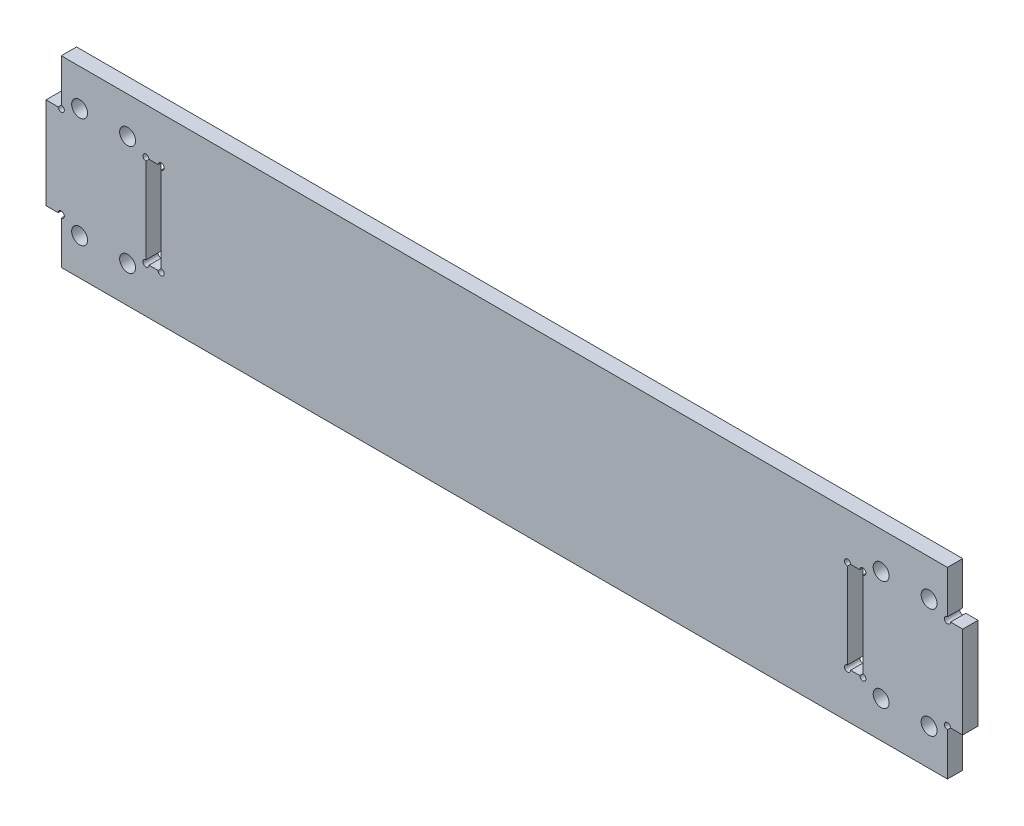
from build123d import *

# Parameters (mm, degrees)
SKETCH_1_W          = 290
SKETCH_1_H          = 60
EXTRUDE_1_DEPTH     = 5
SKETCH_2_W          = 5
SKETCH_2_H          = 30
EXTRUDE_2_DEPTH     = 5
CUT_EXTRUDE_1_DEPTH = 5
CUT_EXTRUDE_2_DEPTH = 5
SKETCH_5_R          = 2.6
CUT_EXTRUDE_3_DEPTH = 302.081384346


with BuildPart() as part:
    # 草图1 → 凸台-拉伸1 (new body)
    with BuildSketch(Plane.XY):
        with Locations((145, -30)):
            Rectangle(SKETCH_1_W, SKETCH_1_H)
    extrude(amount=EXTRUDE_1_DEPTH)

    # 草图2 → 凸台-拉伸2 (add)
    with BuildSketch(Plane.XY.offset(5)):
        with Locations((292.5, -30)):
            Rectangle(SKETCH_2_W, SKETCH_2_H)
        with Locations((-2.5, -30)):
            Rectangle(SKETCH_2_W, SKETCH_2_H)
    extrude(amount=-EXTRUDE_2_DEPTH)

    # 草图3 → 切除-拉伸1 (cut)
    with BuildSketch(Plane(origin=(0, 0, 0), x_dir=(-1, 0, 0), z_dir=(0, 0, -1))):
        with BuildLine():
            Line((1, -15), (0, -15))
            Line((0, -15), (0, -14))
            ThreePointArc((0, -14), (-0.707106781, -15.707106781), (1, -15))
        make_face()
        with BuildLine():
            ThreePointArc((-291, -15), (-289.292893219, -15.707106781), (-290, -14))
            Line((-290, -14), (-290, -15))
            Line((-290, -15), (-291, -15))
        make_face()
        with BuildLine():
            Line((0, -45), (1, -45))
            ThreePointArc((1, -45), (-0.707106781, -44.292893219), (0, -46))
            Line((0, -46), (0, -45))
        make_face()
        with BuildLine():
            ThreePointArc((-290, -46), (-289.292893219, -44.292893219), (-291, -45))
            Line((-291, -45), (-290, -45))
            Line((-290, -45), (-290, -46))
        make_face()
    extrude(amount=-CUT_EXTRUDE_1_DEPTH, mode=Mode.SUBTRACT)

    # 草图4 → 切除-拉伸2 (cut)
    with BuildSketch(Plane(origin=(0, 0, 0), x_dir=(-1, 0, 0), z_dir=(0, 0, -1))):
        with BuildLine():
            ThreePointArc((-261.3, -15), (-263.007106781, -14.292893219), (-262.3, -16))
            Line((-262.3, -16), (-262.3, -44))
            ThreePointArc((-262.3, -44), (-263.007106781, -45.707106781), (-261.3, -45))
            Line((-261.3, -45), (-258.3, -45))
            ThreePointArc((-258.3, -45), (-256.592893219, -45.707106781), (-257.3, -44))
            Line((-257.3, -44), (-257.3, -16))
            ThreePointArc((-257.3, -16), (-256.592893219, -14.292893219), (-258.3, -15))
            Line((-258.3, -15), (-261.3, -15))
        make_face()
        with BuildLine():
            ThreePointArc((-32.7, -44), (-33.407106781, -45.707106781), (-31.7, -45))
            Line((-31.7, -45), (-28.7, -45))
            ThreePointArc((-28.7, -45), (-26.992893219, -45.707106781), (-27.7, -44))
            Line((-27.7, -44), (-27.7, -16))
            ThreePointArc((-27.7, -16), (-26.992893219, -14.292893219), (-28.7, -15))
            Line((-28.7, -15), (-31.7, -15))
            ThreePointArc((-31.7, -15), (-33.407106781, -14.292893219), (-32.7, -16))
            Line((-32.7, -16), (-32.7, -44))
        make_face()
    extrude(amount=-CUT_EXTRUDE_2_DEPTH, mode=Mode.SUBTRACT)

    # 草图5 → 切除-拉伸3 (cut, through all)
    with BuildSketch(Plane.XY.offset(5)):
        with Locations((6, -48)):
            Circle(SKETCH_5_R)
        with Locations((21.7, -48)):
            Circle(SKETCH_5_R)
        with Locations((21.7, -12)):
            Circle(SKETCH_5_R)
        with Locations((6, -12)):
            Circle(SKETCH_5_R)
        with Locations((268.3, -48)):
            Circle(SKETCH_5_R)
        with Locations((284, -48)):
            Circle(SKETCH_5_R)
        with Locations((268.3, -12)):
            Circle(SKETCH_5_R)
        with Locations((284, -12)):
            Circle(SKETCH_5_R)
    extrude(amount=-CUT_EXTRUDE_3_DEPTH, mode=Mode.SUBTRACT)


solid = part.part
